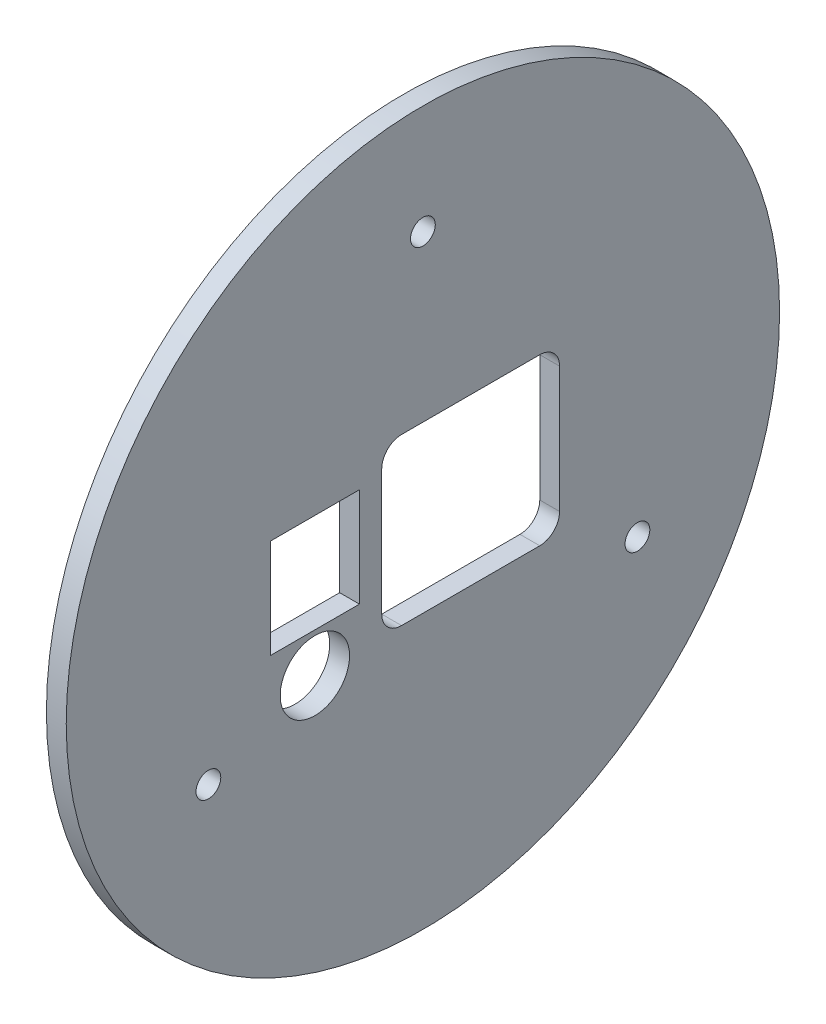
from build123d import *

# Parameters (mm, degrees)
SKETCH1_R           = 72
SKETCH1_R_2         = 7
SKETCH1_R_3         = 2.5
SKETCH1_W           = 18
SKETCH1_H           = 20
BOSS_EXTRUDE1_DEPTH = 4


with BuildPart() as part:
    # Sketch1 → Boss-Extrude1 (new body)
    with BuildSketch(Plane(origin=(0, 0, 0), x_dir=(0, 0, -1), z_dir=(1, 0, 0))):
        Circle(SKETCH1_R)
        with Locations((-21.809754717, -16.7)):
            Circle(SKETCH1_R_2, mode=Mode.SUBTRACT)
        with Locations((0, 50)):
            Circle(SKETCH1_R_3, mode=Mode.SUBTRACT)
        with Locations((43.301270189, -25)):
            Circle(SKETCH1_R_3, mode=Mode.SUBTRACT)
        with Locations((-43.301270189, -25)):
            Circle(SKETCH1_R_3, mode=Mode.SUBTRACT)
        with BuildLine():
            Line((-4.309754717, 16.7), (23.590245283, 16.7))
            ThreePointArc((23.590245283, 16.7), (26.418672408, 15.528427125), (27.590245283, 12.7))
            Line((27.590245283, 12.7), (27.590245283, -12.7))
            ThreePointArc((27.590245283, -12.7), (26.418672408, -15.528427125), (23.590245283, -16.7))
            Line((23.590245283, -16.7), (-4.309754717, -16.7))
            ThreePointArc((-4.309754717, -16.7), (-7.138181842, -15.528427125), (-8.309754717, -12.7))
            Line((-8.309754717, -12.7), (-8.309754717, 12.7))
            ThreePointArc((-8.309754717, 12.7), (-7.138181842, 15.528427125), (-4.309754717, 16.7))
        make_face(mode=Mode.SUBTRACT)
        with Locations((-21.809754717, 1.3)):
            Rectangle(SKETCH1_W, SKETCH1_H, mode=Mode.SUBTRACT)
    extrude(amount=BOSS_EXTRUDE1_DEPTH)


solid = part.part
